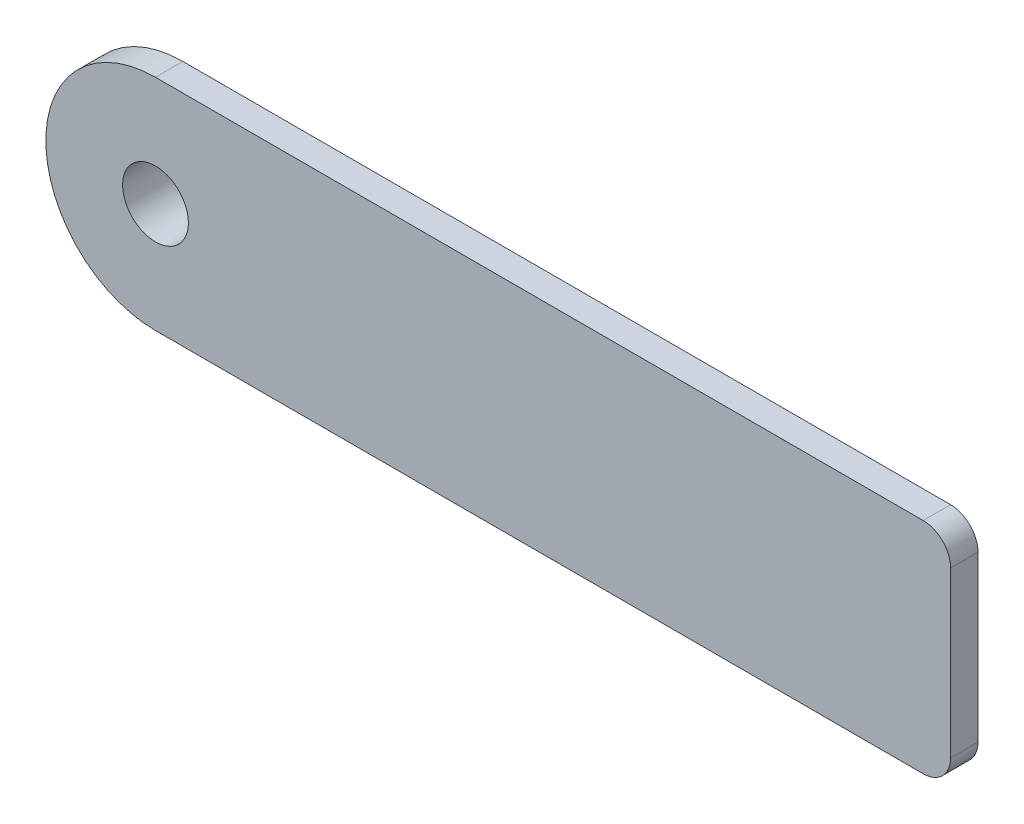
from build123d import *
from build123d.topology import SkipClean

# Parameters (mm, degrees)
SKETCH2_R           = 6
BOSS_EXTRUDE1_DEPTH = 2.5
FILLET1_R           = 5
BOSS_EXTRUDE2_START = 5
SKETCH3_R           = 12
SKETCH3_R_2         = 6
BOSS_EXTRUDE2_DEPTH = 5


with BuildPart() as part:
    # Sketch2 → Boss-Extrude1 (new, symmetric)
    with BuildSketch(Plane.XY):
        with BuildLine():
            Line((145, 20), (0, 20))
            ThreePointArc((0, 20), (-20, 0), (0, -20))
            Line((0, -20), (145, -20))
            Line((145, -20), (145, 20))
        make_face()
        Circle(SKETCH2_R, mode=Mode.SUBTRACT)
    extrude(amount=BOSS_EXTRUDE1_DEPTH, both=True)

    # Fillet1
    fillet1_edges = [part.edges().sort_by_distance(p)[0] for p in [
        (145, -20, 0),
        (145, 20, 0),
    ]]
    fillet(fillet1_edges, radius=FILLET1_R)

    # Sketch3 → Boss-Extrude2 (add)
    with SkipClean():  # the faces are left unmerged after this step: merging them gives an invalid solid
        with BuildSketch(Plane(origin=(0, 0, -2.5), x_dir=(-1, 0, 0), z_dir=(0, 0, -1)).offset(BOSS_EXTRUDE2_START)):
            Circle(SKETCH3_R)
            Circle(SKETCH3_R_2, mode=Mode.SUBTRACT)
        extrude(amount=-BOSS_EXTRUDE2_DEPTH)


solid = part.part
